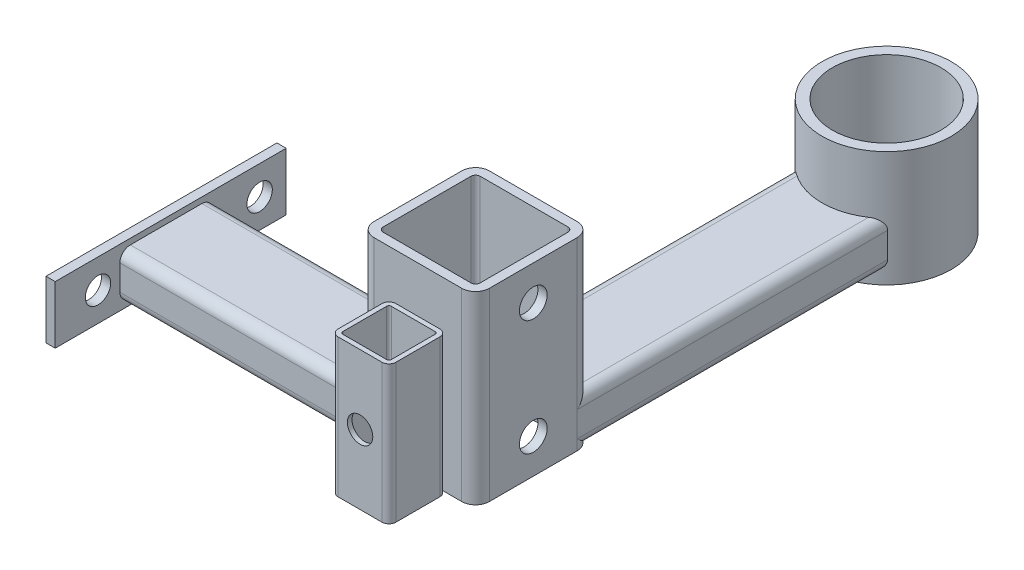
from build123d import *

# Parameters (mm, degrees)
AXBXS_8645_68_40_X_20_X_3_1_DEPTH        = 173.360679775
AXBXS_8645_68_40_X_20_X_3_1_2_DEPTH      = 134
AXBXS_8645_68_40_X_20_X_3_1_2_DEPTH_BACK = 23.360679775
BXBXS_8639_82_50_X_50_X_4_2_DEPTH        = 10
BXBXS_8639_82_50_X_50_X_4_2_2_DEPTH      = 70
WELD_START                               = -10
WELD_TRIM_1_DEPTH                        = 20
WELD_TRIM_1_2_DEPTH                      = 20
EXTRUDE_1_DEPTH                          = 5
EXTRUDE_1_DEPTH_BACK                     = 45
SKETCH_8_R                               = 28
SKETCH_8_R_2                             = 23.5
MOVE_FACE_1_BY                           = 10.151380586
CUT_EXTRUDE_1_DEPTH                      = 261.032690304
CUT_EXTRUDE_1_DEPTH_BACK                 = 261.032690304
SKETCH_10_R                              = 23.5
SKETCH_11_W                              = 100
SKETCH_11_H                              = 25
EXTRUDE_2_DEPTH                          = 4
SKETCH_12_R                              = 5.5
CUT_EXTRUDE_2_DEPTH                      = 4
BXBXS_8639_82_25_X_25_X_2_1_DEPTH        = 60
SKETCH_15_R                              = 5.5
CUT_EXTRUDE_3_DEPTH                      = 2
SKETCH_18_R                              = 6
CUT_EXTRUDE_6_DEPTH                      = 4


# Read off the part's stored shape, not the designer's step: Отсечь/Удлинить1
with BuildPart() as part:
    # Sketch1 on segment 1 (carried to segment 1) → Труба axbxs гост8645-68 40 X 20 X 3(1) (new body)
    with BuildSketch(Plane(origin=(0, 0, -150), x_dir=(0, 1, 0), z_dir=(0, 0, 1))):
        with BuildLine():
            Line((-5.5, -20), (5.5, -20))
            ThreePointArc((5.5, -20), (8.681980515, -18.681980515), (10, -15.5))
            Line((10, -15.5), (10, 15.5))
            ThreePointArc((10, 15.5), (8.681980515, 18.681980515), (5.5, 20))
            Line((5.5, 20), (-5.5, 20))
            ThreePointArc((-5.5, 20), (-8.681980515, 18.681980515), (-10, 15.5))
            Line((-10, 15.5), (-10, -15.5))
            ThreePointArc((-10, -15.5), (-8.681980515, -18.681980515), (-5.5, -20))
        make_face()
        with BuildLine():
            Line((-5.5, -17), (5.5, -17))
            ThreePointArc((5.5, -17), (6.560660172, -16.560660172), (7, -15.5))
            Line((7, -15.5), (7, 15.5))
            ThreePointArc((7, 15.5), (6.560660172, 16.560660172), (5.5, 17))
            Line((5.5, 17), (-5.5, 17))
            ThreePointArc((-5.5, 17), (-6.560660172, 16.560660172), (-7, 15.5))
            Line((-7, 15.5), (-7, -15.5))
            ThreePointArc((-7, -15.5), (-6.560660172, -16.560660172), (-5.5, -17))
        make_face(mode=Mode.SUBTRACT)
    extrude(amount=AXBXS_8645_68_40_X_20_X_3_1_DEPTH)

    # Труба axbxs гост8645-68 40 X 20 X 3(1) mitre 1
    split(bisect_by=Plane(origin=(0, 0, 0), x_dir=(0, 1, 0), z_dir=(0.707106781, 0, -0.707106781)), keep=Keep.TOP)

    # Weld Trim 1 2 outline → Weld Trim 1 2 (cut)
    with BuildSketch(Plane(origin=(0, 0, 0), x_dir=(1, 0, 0), z_dir=(0, 1, 0)).offset(WELD_START)):
        with BuildLine():
            Line((14, 30), (-20, 30))
            Line((-20, 30), (-20, 20))
            Line((-20, 20), (20, -20))
            Line((20, -20), (20, 24))
            ThreePointArc((20, 24), (18.242640687, 28.242640687), (14, 30))
        make_face()
    extrude(amount=WELD_TRIM_1_2_DEPTH, mode=Mode.SUBTRACT)

    # Move Face 1: a face moved outward by 10.151381
    extrude(part.faces().sort_by_distance((0, -8, -150))[0], amount=MOVE_FACE_1_BY, dir=(0, 0, -1))

    # Эскиз10 → Вырез-Вытянуть1 (cut, two sides: drawn at the far end of the back side and taken through both)
    with BuildSketch(Plane.XZ.offset(15).offset(-CUT_EXTRUDE_1_DEPTH_BACK)):
        with Locations((0, -178)):
            Circle(SKETCH_10_R)
    extrude(amount=CUT_EXTRUDE_1_DEPTH + CUT_EXTRUDE_1_DEPTH_BACK, mode=Mode.SUBTRACT)


with BuildPart() as body_2:
    # Sketch1 → axbxs _8645-68 40 X 20 X 3_1 2 (new, two sides: drawn at the far end of the back side and taken through both)
    with BuildSketch(Plane(origin=(0, 0, 0), x_dir=(0, 1, 0), z_dir=(-1, 0, 0)).offset(-AXBXS_8645_68_40_X_20_X_3_1_2_DEPTH_BACK)):
        with BuildLine():
            Line((-5.5, -20), (5.5, -20))
            ThreePointArc((5.5, -20), (8.681980515, -18.681980515), (10, -15.5))
            Line((10, -15.5), (10, 15.5))
            ThreePointArc((10, 15.5), (8.681980515, 18.681980515), (5.5, 20))
            Line((5.5, 20), (-5.5, 20))
            ThreePointArc((-5.5, 20), (-8.681980515, 18.681980515), (-10, 15.5))
            Line((-10, 15.5), (-10, -15.5))
            ThreePointArc((-10, -15.5), (-8.681980515, -18.681980515), (-5.5, -20))
        make_face()
        with BuildLine():
            Line((-5.5, -17), (5.5, -17))
            ThreePointArc((5.5, -17), (6.560660172, -16.560660172), (7, -15.5))
            Line((7, -15.5), (7, 15.5))
            ThreePointArc((7, 15.5), (6.560660172, 16.560660172), (5.5, 17))
            Line((5.5, 17), (-5.5, 17))
            ThreePointArc((-5.5, 17), (-6.560660172, 16.560660172), (-7, 15.5))
            Line((-7, 15.5), (-7, -15.5))
            ThreePointArc((-7, -15.5), (-6.560660172, -16.560660172), (-5.5, -17))
        make_face(mode=Mode.SUBTRACT)
    extrude(amount=AXBXS_8645_68_40_X_20_X_3_1_2_DEPTH + AXBXS_8645_68_40_X_20_X_3_1_2_DEPTH_BACK)

    # axbxs _8645-68 40 X 20 X 3_1 2 mitre 1
    split(bisect_by=Plane(origin=(0, 0, 0), x_dir=(0, -1, 0), z_dir=(-0.707106781, 0, 0.707106781)), keep=Keep.TOP)

    # Weld Trim 1 outline → Weld Trim 1 (cut)
    with BuildSketch(Plane(origin=(0, 0, 0), x_dir=(1, 0, 0), z_dir=(0, 1, 0)).offset(WELD_START)):
        with BuildLine():
            ThreePointArc((-30, -14), (-28.242640687, -18.242640687), (-24, -20))
            Line((-24, -20), (20, -20))
            Line((20, -20), (-20, 20))
            Line((-20, 20), (-30, 20))
            Line((-30, 20), (-30, -14))
        make_face()
    extrude(amount=WELD_TRIM_1_DEPTH, mode=Mode.SUBTRACT)


with BuildPart() as body_3:
    # Sketch14 → Труба bxbxs гост8639-82 50 X 50 X 4(2) (new body)
    with BuildSketch(Plane(origin=(-5, 0, -5), x_dir=(1, 0, 0), z_dir=(0, 1, 0))):
        with BuildLine():
            Line((-19, -25), (19, -25))
            ThreePointArc((19, -25), (23.242640687, -23.242640687), (25, -19))
            Line((25, -19), (25, 19))
            ThreePointArc((25, 19), (23.242640687, 23.242640687), (19, 25))
            Line((19, 25), (-19, 25))
            ThreePointArc((-19, 25), (-23.242640687, 23.242640687), (-25, 19))
            Line((-25, 19), (-25, -19))
            ThreePointArc((-25, -19), (-23.242640687, -23.242640687), (-19, -25))
        make_face()
        with BuildLine():
            Line((-19, -21), (19, -21))
            ThreePointArc((19, -21), (20.414213562, -20.414213562), (21, -19))
            Line((21, -19), (21, 19))
            ThreePointArc((21, 19), (20.414213562, 20.414213562), (19, 21))
            Line((19, 21), (-19, 21))
            ThreePointArc((-19, 21), (-20.414213562, 20.414213562), (-21, 19))
            Line((-21, 19), (-21, -19))
            ThreePointArc((-21, -19), (-20.414213562, -20.414213562), (-19, -21))
        make_face(mode=Mode.SUBTRACT)
    extrude(amount=-BXBXS_8639_82_50_X_50_X_4_2_DEPTH)


with BuildPart() as body_4:
    # Sketch14 on segment 2 (carried to segment 2) → bxbxs _8639-82 50 X 50 X 4_2 2 (new body)
    with BuildSketch(Plane(origin=(-5, 0, -5), x_dir=(1, 0, 0), z_dir=(0, 1, 0))):
        with BuildLine():
            Line((-19, -25), (19, -25))
            ThreePointArc((19, -25), (23.242640687, -23.242640687), (25, -19))
            Line((25, -19), (25, 19))
            ThreePointArc((25, 19), (23.242640687, 23.242640687), (19, 25))
            Line((19, 25), (-19, 25))
            ThreePointArc((-19, 25), (-23.242640687, 23.242640687), (-25, 19))
            Line((-25, 19), (-25, -19))
            ThreePointArc((-25, -19), (-23.242640687, -23.242640687), (-19, -25))
        make_face()
        with BuildLine():
            Line((-19, -21), (19, -21))
            ThreePointArc((19, -21), (20.414213562, -20.414213562), (21, -19))
            Line((21, -19), (21, 19))
            ThreePointArc((21, 19), (20.414213562, 20.414213562), (19, 21))
            Line((19, 21), (-19, 21))
            ThreePointArc((-19, 21), (-20.414213562, 20.414213562), (-21, 19))
            Line((-21, 19), (-21, -19))
            ThreePointArc((-21, -19), (-20.414213562, -20.414213562), (-19, -21))
        make_face(mode=Mode.SUBTRACT)
    extrude(amount=BXBXS_8639_82_50_X_50_X_4_2_2_DEPTH)


with BuildPart() as body_5:
    # Эскиз8 → Бобышка-Вытянуть1 (new, two sides: drawn at the far end of the back side and taken through both)
    with BuildSketch(Plane.XZ.offset(10).offset(-EXTRUDE_1_DEPTH_BACK)):
        with Locations((0, -178)):
            Circle(SKETCH_8_R)
        with Locations((0, -178)):
            Circle(SKETCH_8_R_2, mode=Mode.SUBTRACT)
    extrude(amount=EXTRUDE_1_DEPTH + EXTRUDE_1_DEPTH_BACK)


with BuildPart() as body_6:
    # Эскиз11 → Бобышка-Вытянуть2 (new body)
    with BuildSketch(Plane.ZY.offset(134)):
        with Locations((-2, 0)):
            Rectangle(SKETCH_11_W, SKETCH_11_H)
    extrude(amount=EXTRUDE_2_DEPTH)

    # Эскиз12 → Вырез-Вытянуть2 (cut)
    with BuildSketch(Plane.ZY.offset(138)):
        with Locations((-40.5, 0)):
            Circle(SKETCH_12_R)
        with Locations((29.5, 0)):
            Circle(SKETCH_12_R)
    extrude(amount=-CUT_EXTRUDE_2_DEPTH, mode=Mode.SUBTRACT)


with BuildPart() as body_7:
    # Sketch15 → Труба bxbxs гост8639-82 25 X 25 X 2(1) (new body)
    with BuildSketch(Plane(origin=(-5, -10, 32.5), x_dir=(1, 0, 0), z_dir=(0, 1, 0))):
        with BuildLine():
            Line((-9.5, -12.5), (9.5, -12.5))
            ThreePointArc((9.5, -12.5), (11.621320344, -11.621320344), (12.5, -9.5))
            Line((12.5, -9.5), (12.5, 9.5))
            ThreePointArc((12.5, 9.5), (11.621320344, 11.621320344), (9.5, 12.5))
            Line((9.5, 12.5), (-9.5, 12.5))
            ThreePointArc((-9.5, 12.5), (-11.621320344, 11.621320344), (-12.5, 9.5))
            Line((-12.5, 9.5), (-12.5, -9.5))
            ThreePointArc((-12.5, -9.5), (-11.621320344, -11.621320344), (-9.5, -12.5))
        make_face()
        with BuildLine():
            Line((-9.5, -10.5), (9.5, -10.5))
            ThreePointArc((9.5, -10.5), (10.207106781, -10.207106781), (10.5, -9.5))
            Line((10.5, -9.5), (10.5, 9.5))
            ThreePointArc((10.5, 9.5), (10.207106781, 10.207106781), (9.5, 10.5))
            Line((9.5, 10.5), (-9.5, 10.5))
            ThreePointArc((-9.5, 10.5), (-10.207106781, 10.207106781), (-10.5, 9.5))
            Line((-10.5, 9.5), (-10.5, -9.5))
            ThreePointArc((-10.5, -9.5), (-10.207106781, -10.207106781), (-9.5, -10.5))
        make_face(mode=Mode.SUBTRACT)
    extrude(amount=BXBXS_8639_82_25_X_25_X_2_1_DEPTH)

    # Эскиз15 → Вырез-Вытянуть3 (cut)
    with BuildSketch(Plane.XY.offset(45)):
        with Locations((-5, 20)):
            Circle(SKETCH_15_R)
    extrude(amount=-CUT_EXTRUDE_3_DEPTH, mode=Mode.SUBTRACT)


with BuildPart() as body_3_1:
    add(body_3.part)

    # Combine 1: union body 4
    add(body_4.part)

    # Эскиз18 → Вырез-Вытянуть6 (cut)
    with BuildSketch(Plane(origin=(20, 0, 0), x_dir=(0, 0, -1), z_dir=(1, 0, 0))):
        with Locations((5, 55)):
            Circle(SKETCH_18_R)
        with Locations((5, 5)):
            Circle(SKETCH_18_R)
    extrude(amount=-CUT_EXTRUDE_6_DEPTH, mode=Mode.SUBTRACT)


solid = Compound([part.part, body_2.part, body_5.part, body_6.part, body_7.part, body_3_1.part])
